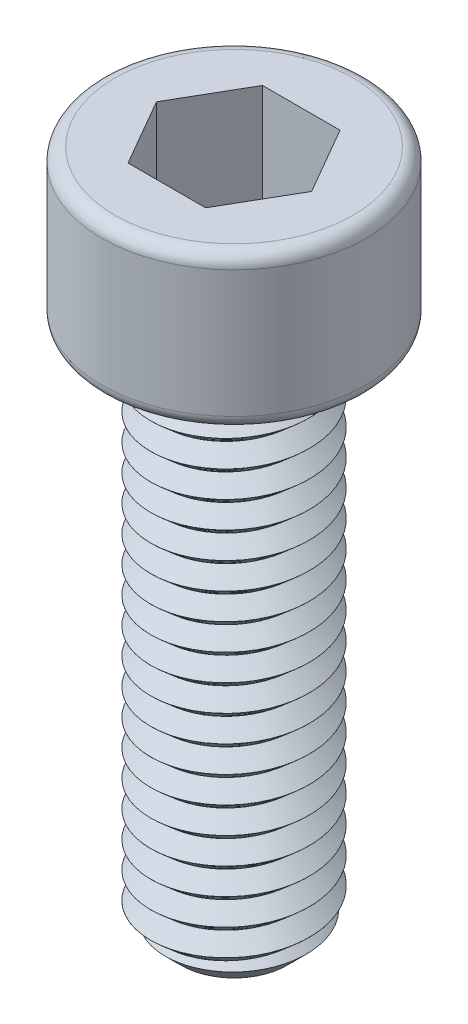
from build123d import *

# Parameters (mm, degrees)
SKETCH1_R           = 3
BOSS_EXTRUDE1_DEPTH = 20
SKETCH2_R           = 5
BOSS_EXTRUDE2_DEPTH = 5.8
CUT_EXTRUDE1_DEPTH  = 4.2
FILLET3_R           = 0.5
CHAMFER1_SIZE       = 1
CUT_SWEEP1_PITCH    = 1


with BuildPart() as part:
    # Sketch1 → Boss-Extrude1 (new body)
    with BuildSketch(Plane(origin=(0, 0, 0), x_dir=(1, 0, 0), z_dir=(0, 1, 0))):
        with Locations(Location((0, 0, 0), (0, 0, 270))):
            Circle(SKETCH1_R)
    extrude(amount=BOSS_EXTRUDE1_DEPTH)

    # Sketch2 → Boss-Extrude2 (add)
    with BuildSketch(Plane(origin=(0, 20, 0), x_dir=(1, 0, 0), z_dir=(0, 1, 0))):
        with Locations(Location((0, 0, 0), (0, 0, 270))):
            Circle(SKETCH2_R)
    extrude(amount=BOSS_EXTRUDE2_DEPTH)

    # Sketch3 → Cut-Extrude1 (cut)
    with BuildSketch(Plane(origin=(0, 25.8, 0), x_dir=(1, 0, 0), z_dir=(0, 1, 0))):
        Polygon((2.932939367, 0), (1.466469684, 2.54), (-1.466469684, 2.54), (-2.932939367, 0), (-1.466469684, -2.54), (1.466469684, -2.54), align=None)
    extrude(amount=-CUT_EXTRUDE1_DEPTH, mode=Mode.SUBTRACT)

    # Fillet3
    fillet3_edges = [part.edges().sort_by_distance(p)[0] for p in [
        (0, 20, -5),
        (0, 25.8, -5),
    ]]
    fillet(fillet3_edges, radius=FILLET3_R)

    # Chamfer1
    chamfer1_edges = [part.edges().sort_by_distance(p)[0] for p in [
        (0, 0, -3),
    ]]
    chamfer(chamfer1_edges, length=CHAMFER1_SIZE)

    # Cut-Sweep1: the profile of Sketch4 screwed along a right-hand helix of 19 turns, 8 arcs to a turn; built about Z, then put on its axis
    cut_sweep1_z = Axis((0, 0, 0), (0, 0, 1))
    cut_sweep1_corners = [(2.43, 0, 0), (3, 0, 0.499), (3, 0, 0), (3, 0, -0.499)]
    with BuildLine(mode=Mode.PRIVATE) as cut_sweep1_profile:
        Line(cut_sweep1_corners[0], cut_sweep1_corners[1])
        Line(cut_sweep1_corners[1], cut_sweep1_corners[2])
        Line(cut_sweep1_corners[2], cut_sweep1_corners[3])
        Line(cut_sweep1_corners[3], cut_sweep1_corners[0])
    cut_sweep1_cap = Face(cut_sweep1_profile.wire())
    cut_sweep1_turn_angles = [0, 22.5, 45, 67.5, 90, 112.5, 135, 157.5, 180, 202.5, 225, 247.5, 270, 292.5, 315, 337.5, 360]
    cut_sweep1_turn_weights = [1, 0.9238795325112867, 1, 0.9238795325112867, 1, 0.9238795325112867, 1, 0.9238795325112867, 1, 0.9238795325112867, 1, 0.9238795325112867, 1, 0.9238795325112867, 1, 0.9238795325112867, 1]
    cut_sweep1_turn_rails = [Edge.make_bspline([Vector(p[0], p[1], 0).rotate(cut_sweep1_z, cut_sweep1_turn_angles[k]) / cut_sweep1_turn_weights[k] + Vector(0, 0, p[2] + CUT_SWEEP1_PITCH * cut_sweep1_turn_angles[k] / 360) for k in range(17)], [0, 0, 0, 1, 1, 2, 2, 3, 3, 4, 4, 5, 5, 6, 6, 7, 7, 8, 8, 8], 2, cut_sweep1_turn_weights) for p in cut_sweep1_corners]
    cut_sweep1_turn_sides = [Face.make_surface_from_curves(cut_sweep1_turn_rails[p[0]], cut_sweep1_turn_rails[p[1]]) for p in [(0, 1), (1, 2), (2, 3), (3, 0)]]
    cut_sweep1 = Plane(origin=(0, 0, 0), x_dir=(1, 0, 0), z_dir=(0, 1, 0)) * Solid(Shell([*[p.moved(Location((0, 0, CUT_SWEEP1_PITCH * i))) for i in range(19) for p in cut_sweep1_turn_sides], cut_sweep1_cap, cut_sweep1_cap.rotate(cut_sweep1_z, 6840).moved(Location((0, 0, CUT_SWEEP1_PITCH * 6840 / 360)))]))
    add(cut_sweep1, mode=Mode.SUBTRACT)


solid = part.part
